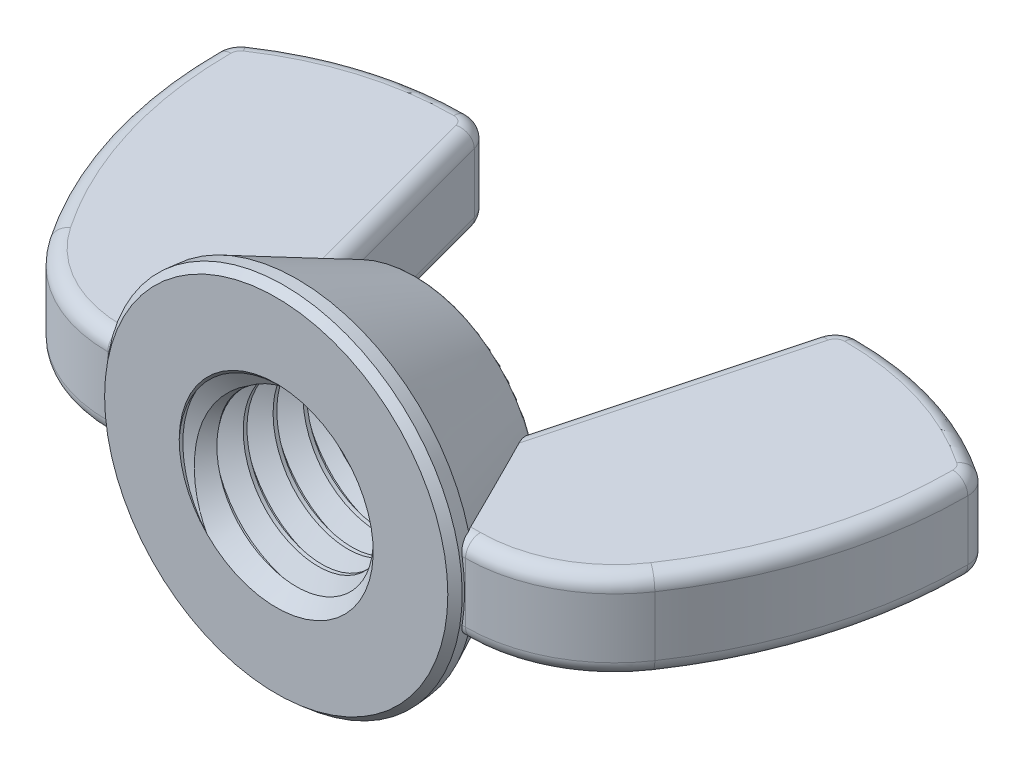
from build123d import *

# Parameters (mm, degrees)
EXTRUDE2_DEPTH     = 2.926953125
SKETCH3_R          = 11.7078125
EXTRUDE1_DEPTH     = 1.3716
EXTRUDE1_DRAFT     = -5
SKETCH15_R         = 11.587813049
EXTRUDE3_DEPTH     = 7.7724
EXTRUDE3_TAPER     = 25.529880773
FILLET3_R          = 0.254
SKETCH4_R          = 6.35
CUT_EXTRUDE1_DEPTH = 38.25185113
SWEEP1_PITCH       = 1.953846154
SKETCH7_R          = 11.7078125
CUT_EXTRUDE2_DEPTH = 38.251851161
SKETCH8_R          = 11.587813049
CUT_EXTRUDE3_DEPTH = 32.730079592
SKETCH11_R         = 6.2992
CUT_EXTRUDE5_DEPTH = 32.730079555
CUT_EXTRUDE5_TAPER = 45
CHAMFER1_SIZE      = 0.51435
CHAMFER1_SIZE2     = 0.474777118
FILLET4_R          = 0.975651042


with BuildPart() as part:
    # Sketch13 → Extrude2 (new, symmetric)
    with BuildSketch(Plane(origin=(0, 0, 0), x_dir=(1, 0, 0), z_dir=(0, 1, 0))):
        with BuildLine():
            Line((7.196031903, 0.6858), (11.7078125, 0.6858))
            ThreePointArc((11.7078125, 0.6858), (16.28893755, 1.826317119), (19.800577665, 4.981609455))
            ThreePointArc((19.800577665, 4.981609455), (23.377870172, 12.461542104), (24.60625, 20.661389487))
            ThreePointArc((24.60625, 20.661389487), (24.415912828, 21.424790186), (23.889460162, 22.009475106))
            ThreePointArc((23.889460162, 22.009475106), (18.597865218, 24.533436423), (12.799552934, 25.4))
            ThreePointArc((12.799552934, 25.4), (11.809655064, 25.063974952), (11.22887537, 24.194776715))
            Line((11.22887537, 24.194776715), (7.196031903, 9.144))
            Line((7.196031903, 9.144), (7.196031903, 0.6858))
        make_face()
    extrude(amount=EXTRUDE2_DEPTH, both=True)

    # Fillet4
    fillet4_edges = [part.edges().sort_by_distance(p)[0] for p in [
        (16.28893755, 2.926953125, -1.826317119),
        (23.377870172, 2.926953125, -12.461542104),
        (24.415912828, 2.926953125, -21.424790186),
        (18.597865218, 2.926953125, -24.533436423),
        (11.809655064, 2.926953125, -25.063974952),
        (9.212453637, 2.926953125, -16.669388358),
        (9.212453637, -2.926953125, -16.669388358),
        (9.451922202, 2.926953125, -0.6858),
        (11.809655064, -2.926953125, -25.063974952),
        (18.597865218, -2.926953125, -24.533436423),
        (24.415912828, -2.926953125, -21.424790186),
        (23.377870172, -2.926953125, -12.461542104),
        (16.28893755, -2.926953125, -1.826317119),
        (9.451922202, -2.926953125, -0.6858),
    ]]
    fillet(fillet4_edges, radius=FILLET4_R)


with BuildPart() as body_2:
    # Sketch3 → Extrude1 (with draft: the straight prism first)
    with BuildSketch(Plane.XY):
        Circle(SKETCH3_R)
    extrude(amount=-EXTRUDE1_DEPTH)
    # Extrude1: the draft: its side faces are tilted about the plane it starts from
    extrude1_sides = [body_2.faces().sort_by_distance(p)[0] for p in [
        (-11.7078125, 0, -0.6858),
    ]]
    draft(extrude1_sides, Plane.XY, EXTRUDE1_DRAFT)

    # Sketch15 → Extrude3 (add)
    with BuildSketch(Plane(origin=(0, 0, -1.3716), x_dir=(-1, 0, 0), z_dir=(0, 0, -1))):
        Circle(SKETCH15_R)
    extrude(amount=EXTRUDE3_DEPTH, taper=EXTRUDE3_TAPER)

    # Fillet3
    fillet3_edges = [body_2.edges().sort_by_distance(p)[0] for p in [
        (7.875591553, 0, -9.144),
    ]]
    fillet(fillet3_edges, radius=FILLET3_R)

    # Sketch4 → Cut-Extrude1 (cut, through all)
    with BuildSketch(Plane.XY):
        Circle(SKETCH4_R)
    extrude(amount=-CUT_EXTRUDE1_DEPTH, mode=Mode.SUBTRACT)

    # Sweep1: arcs per turn and ends read off the stored shape
    # Sweep1: the profile of Sketch6 profile screwed along a right-hand helix through 7 turns, 6 arcs to a turn; built about Z, then put on its axis
    sweep1_z = Axis((0, 0, 0), (0, 0, 1))
    sweep1_corners = [(6.3503, 0, -1.70978859), (5.080939697, 0, -0.976923077), (5.080939697, 0, -0.732692308), (6.3503, 0, 0.000173205)]
    with BuildLine(mode=Mode.PRIVATE) as sweep1_profile:
        Line(sweep1_corners[0], sweep1_corners[1])
        Line(sweep1_corners[1], sweep1_corners[2])
        Line(sweep1_corners[2], sweep1_corners[3])
        Line(sweep1_corners[3], sweep1_corners[0])
    sweep1_cap = Face(sweep1_profile.wire())
    sweep1_turn_angles = [0, 30, 60, 90, 120, 150, 180, 210, 240, 270, 300, 330, 360]
    sweep1_turn_weights = [1, 0.8660254037844387, 1, 0.8660254037844387, 1, 0.8660254037844387, 1, 0.8660254037844387, 1, 0.8660254037844387, 1, 0.8660254037844387, 1]
    sweep1_turn_rails = [Edge.make_bspline([Vector(p[0], p[1], 0).rotate(sweep1_z, sweep1_turn_angles[k]) / sweep1_turn_weights[k] + Vector(0, 0, p[2] + SWEEP1_PITCH * sweep1_turn_angles[k] / 360) for k in range(13)], [0, 0, 0, 1, 1, 2, 2, 3, 3, 4, 4, 5, 5, 6, 6, 6], 2, sweep1_turn_weights) for p in sweep1_corners]
    sweep1_turn_sides = [Face.make_surface_from_curves(sweep1_turn_rails[p[0]], sweep1_turn_rails[p[1]]) for p in [(0, 1), (1, 2), (2, 3), (3, 0)]]
    sweep1 = Plane(origin=(0, 0, 0), x_dir=(-1, 0, 0), z_dir=(0, 0, -1)) * Solid(Shell([*[p.moved(Location((0, 0, SWEEP1_PITCH * i))) for i in range(7) for p in sweep1_turn_sides], sweep1_cap, sweep1_cap.rotate(sweep1_z, 2520).moved(Location((0, 0, SWEEP1_PITCH * 2520 / 360)))]))
    add(sweep1)

    # Sketch7 → Cut-Extrude2 (cut, through all)
    with BuildSketch(Plane.XY):
        Circle(SKETCH7_R)
    extrude(amount=CUT_EXTRUDE2_DEPTH, mode=Mode.SUBTRACT)

    # Sketch8 → Cut-Extrude3 (cut, through all)
    with BuildSketch(Plane.XY.offset(-9.144)):
        Circle(SKETCH8_R)
    extrude(amount=-CUT_EXTRUDE3_DEPTH, mode=Mode.SUBTRACT)

    # Cut-Extrude4 cone 1 section (through the dimple's axis) → Cut-Extrude4 (revolve, cut)
    with BuildSketch(Plane(origin=(0, 0, 0), x_dir=(0, -1, 0), z_dir=(1, 0, 0))):
        Polygon((0, 0), (6.35, 0), (0, 6.35), align=None)
    revolve(axis=Axis((0, 0, 0), (0, 0, -1)), mode=Mode.SUBTRACT)

    # Sketch11 → Cut-Extrude5 (cut, through all)
    with BuildSketch(Plane.XY.offset(-9.144)):
        Circle(SKETCH11_R)
    extrude(amount=CUT_EXTRUDE5_DEPTH, taper=CUT_EXTRUDE5_TAPER, mode=Mode.SUBTRACT)

    # Chamfer1
    chamfer1_edges = [body_2.edges().sort_by_distance(p)[0] for p in [
        (-11.7078125, 0, 0),
    ]]
    chamfer1_side = [body_2.faces().sort_by_distance(p)[0] for p in [
        (-11.647812775, 0, -0.6858),
    ]]
    chamfer(chamfer1_edges, length=CHAMFER1_SIZE, length2=CHAMFER1_SIZE2, reference=chamfer1_side[0])


with BuildPart() as body_3:
    # Mirror6: mirrored copy
    add(part.part.mirror(Plane(origin=(0, 0, 0), x_dir=(0, 0, 1), z_dir=(1, 0, 0))))

    # Combine2: union part, body 2
    add(part.part)
    add(body_2.part)


solid = body_3.part
